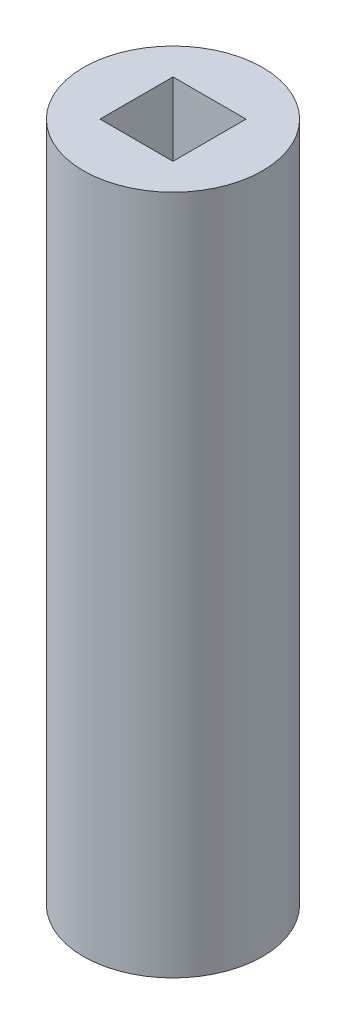
from build123d import *

# Parameters (mm, degrees)
SKETCH_1_R      = 12.5
SKETCH_1_W      = 10.2
SKETCH_1_H      = 10.2
EXTRUDE_1_DEPTH = 95


with BuildPart() as part:
    # Эскиз1 → Бобышка-Вытянуть1 (new body)
    with BuildSketch(Plane(origin=(0, 0, 0), x_dir=(1, 0, 0), z_dir=(0, 1, 0))):
        Circle(SKETCH_1_R)
        Rectangle(SKETCH_1_W, SKETCH_1_H, mode=Mode.SUBTRACT)
    extrude(amount=EXTRUDE_1_DEPTH)


solid = part.part
